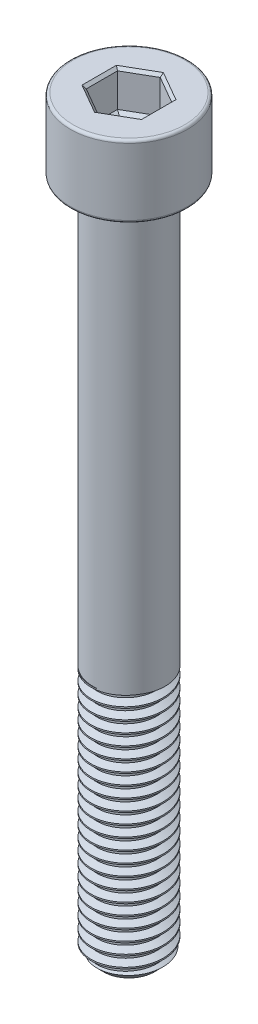
from build123d import *

# Parameters (mm, degrees)
SKETCH1_R           = 4
BOSS_EXTRUDE1_DEPTH = 28
THREAD1_PITCH       = 1.25
SKETCH2_R           = 4
BOSS_EXTRUDE2_DEPTH = 47
SKETCH5_R           = 6.5
BOSS_EXTRUDE3_DEPTH = 8
FILLET1_R           = 0.3
CUT_EXTRUDE1_DEPTH  = 4
CHAMFER1_SIZE       = 0.3
CUT_EXTRUDE2_DEPTH  = 0.4
CUT_EXTRUDE2_DRAFT  = -60


with BuildPart() as part:
    # Sketch1 → Boss-Extrude1 (new body)
    with BuildSketch(Plane(origin=(0, 0, 0), x_dir=(1, 0, 0), z_dir=(0, 1, 0))):
        with Locations(Location((0, 0, 0), (0, 0, 270))):
            Circle(SKETCH1_R)
    extrude(amount=BOSS_EXTRUDE1_DEPTH)

    # Thread1: the profile of Thread Profile1 profile screwed along a right-hand helix of 24 turns, 8 arcs to a turn; built about Z, then put on its axis
    thread1_z = Axis((0, 0, 0), (0, 0, 1))
    thread1_corners = [(4.0003, 0, -0.000173205), (4.0003, 0, 1.093923202), (3.323417656, 0, 0.703124998), (3.323417656, 0, 0.390624998)]
    with BuildLine(mode=Mode.PRIVATE) as thread1_profile:
        Line(thread1_corners[0], thread1_corners[1])
        Line(thread1_corners[1], thread1_corners[2])
        Line(thread1_corners[2], thread1_corners[3])
        Line(thread1_corners[3], thread1_corners[0])
    thread1_cap = Face(thread1_profile.wire())
    thread1_turn_angles = [0, 22.5, 45, 67.5, 90, 112.5, 135, 157.5, 180, 202.5, 225, 247.5, 270, 292.5, 315, 337.5, 360]
    thread1_turn_weights = [1, 0.9238795325112867, 1, 0.9238795325112867, 1, 0.9238795325112867, 1, 0.9238795325112867, 1, 0.9238795325112867, 1, 0.9238795325112867, 1, 0.9238795325112867, 1, 0.9238795325112867, 1]
    thread1_turn_rails = [Edge.make_bspline([Vector(p[0], p[1], 0).rotate(thread1_z, thread1_turn_angles[k]) / thread1_turn_weights[k] + Vector(0, 0, p[2] + THREAD1_PITCH * thread1_turn_angles[k] / 360) for k in range(17)], [0, 0, 0, 1, 1, 2, 2, 3, 3, 4, 4, 5, 5, 6, 6, 7, 7, 8, 8, 8], 2, thread1_turn_weights) for p in thread1_corners]
    thread1_turn_sides = [Face.make_surface_from_curves(thread1_turn_rails[p[0]], thread1_turn_rails[p[1]]) for p in [(0, 1), (1, 2), (2, 3), (3, 0)]]
    thread1 = Plane(origin=(0, 30, 0), x_dir=(-1, 0, 0), z_dir=(0, -1, 0)) * Solid(Shell([*[p.moved(Location((0, 0, THREAD1_PITCH * i))) for i in range(24) for p in thread1_turn_sides], thread1_cap, thread1_cap.rotate(thread1_z, 8640).moved(Location((0, 0, THREAD1_PITCH * 8640 / 360)))]))
    add(thread1, mode=Mode.SUBTRACT)

    # Sketch2 → Boss-Extrude2 (add)
    with BuildSketch(Plane(origin=(0, 28, 0), x_dir=(1, 0, 0), z_dir=(0, 1, 0))):
        with Locations(Location((0, 0, 0), (0, 0, 117.593571361))):
            Circle(SKETCH2_R)
    extrude(amount=BOSS_EXTRUDE2_DEPTH)

    # Sketch5 → Boss-Extrude3 (add)
    with BuildSketch(Plane(origin=(0, 75, 0), x_dir=(1, 0, 0), z_dir=(0, 1, 0))):
        with Locations(Location((0, 0, 0), (0, 0, 270))):
            Circle(SKETCH5_R)
    extrude(amount=BOSS_EXTRUDE3_DEPTH)

    # Sketch6 → Cut-Revolve1 (revolve, cut)
    with BuildSketch(Plane.XY, mode=Mode.PRIVATE) as cut_revolve1_sk:
        Polygon((4.01, 0), (4.01, 1.2), (2.81, 0), align=None)
    revolve(cut_revolve1_sk.sketch.rotate(Axis((0, 0, 0), (0, 1, 0)), 117.593571361), axis=Axis((0, 0, 0), (0, 1, 0)), mode=Mode.SUBTRACT)

    # Fillet1
    fillet1_edges = [part.edges().sort_by_distance(p)[0] for p in [
        (0, 75, -6.5),
        (0, 83, -6.5),
    ]]
    fillet(fillet1_edges, radius=FILLET1_R)

    # Sketch7 → Cut-Extrude1 (cut)
    with BuildSketch(Plane(origin=(0, 83, 0), x_dir=(1, 0, 0), z_dir=(0, 1, 0))):
        Polygon((0, 3.464101615), (-3, 1.732050808), (-3, -1.732050808), (0, -3.464101615), (3, -1.732050808), (3, 1.732050808), align=None)
    extrude(amount=-CUT_EXTRUDE1_DEPTH, mode=Mode.SUBTRACT)

    # Chamfer1
    chamfer1_edges = [part.edges().sort_by_distance(p)[0] for p in [
        (1.5, 83, -2.598076211),
        (-1.5, 83, -2.598076211),
        (-3, 83, 0),
        (-1.5, 83, 2.598076211),
        (1.5, 83, 2.598076211),
        (3, 83, 0),
    ]]
    chamfer(chamfer1_edges, length=CHAMFER1_SIZE)


with BuildPart() as cut_extrude2_tool:
    # Sketch8 → Cut-Extrude2 (with draft: the straight prism first)
    with BuildSketch(Plane(origin=(0, 79, 0), x_dir=(1, 0, 0), z_dir=(0, 1, 0))):
        Polygon((0, 3.464101615), (-3, 1.732050808), (-3, -1.732050808), (0, -3.464101615), (3, -1.732050808), (3, 1.732050808), align=None)
    extrude(amount=-CUT_EXTRUDE2_DEPTH)
    # Cut-Extrude2: the draft: its side faces are tilted about the plane it starts from
    cut_extrude2_sides = [cut_extrude2_tool.faces().sort_by_distance(p)[0] for p in [
        (-1.5, 78.8, -2.598076211),
        (-3, 78.8, 0),
        (-1.5, 78.8, 2.598076211),
        (1.5, 78.8, 2.598076211),
        (3, 78.8, 0),
        (1.5, 78.8, -2.598076211),
    ]]
    draft(cut_extrude2_sides, Plane(origin=(0, 79, 0), x_dir=(1, 0, 0), z_dir=(0, 1, 0)), CUT_EXTRUDE2_DRAFT)


with BuildPart() as part_1:
    add(part.part)

    # Cut-Extrude2: cut by cut_extrude2_tool
    add(cut_extrude2_tool.part, mode=Mode.SUBTRACT)


solid = part_1.part
